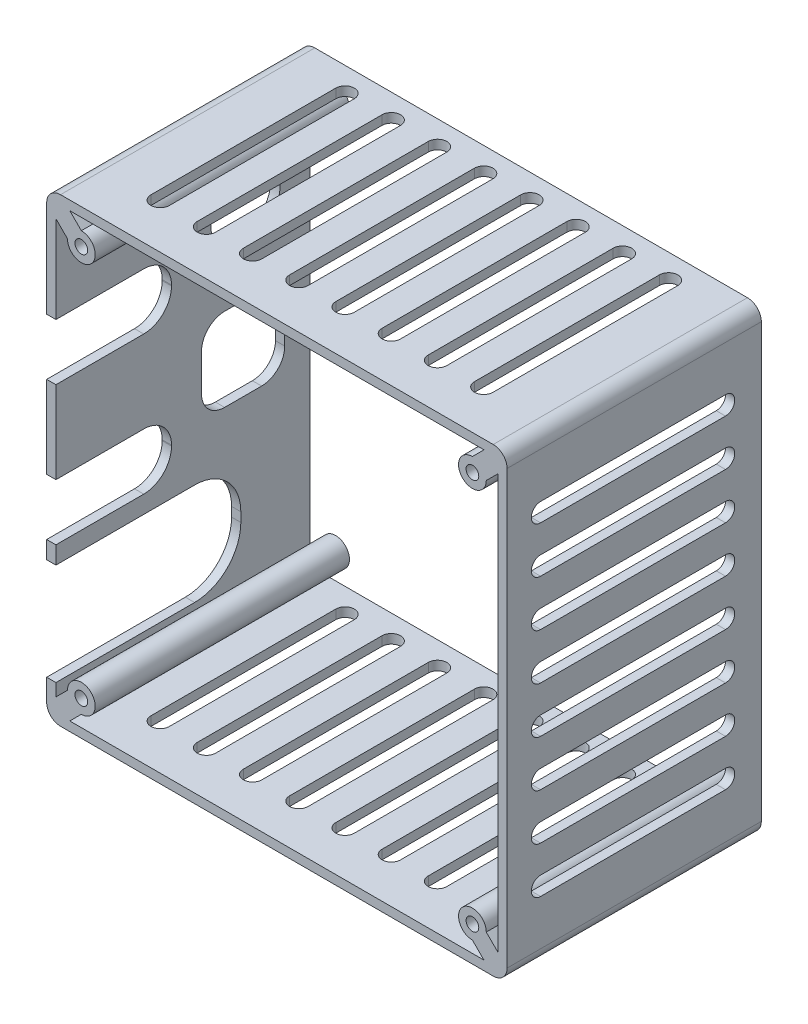
from build123d import *

# Parameters (mm, degrees)
BOSS_EXTRUDE1_DEPTH      = 3
BOSS_EXTRUDE1_DEPTH_BACK = 1.5
SKETCH1_W                = 99.6
SKETCH1_H                = 99.6
SKETCH1_R                = 7.5
SKETCH2_W                = 99.6
SKETCH2_H                = 99.6
SKETCH2_W_2              = 95.6
SKETCH2_H_2              = 95.6
BOSS_EXTRUDE2_DEPTH      = 55
FILLET1_R                = 3
SKETCH5_R                = 3
BOSS_EXTRUDE4_DEPTH      = 55
SKETCH6_R                = 1.375
CUT_EXTRUDE2_DEPTH       = 10
CUT_EXTRUDE4_START       = -99.6
CUT_EXTRUDE4_DEPTH       = 99.6
SKETCH8_W                = 25
SKETCH8_H                = 12.2
CUT_EXTRUDE5_DEPTH       = 10
CUT_EXTRUDE13_DEPTH      = 4.5
SKETCH20_7_W             = 13.718214861
SKETCH20_7_H             = 12
CUT_EXTRUDE16_DEPTH      = 4.5
CUT_EXTRUDE17_DEPTH      = 10
SKETCH26_R               = 2
CUT_EXTRUDE21_DEPTH      = 4.5
SKETCH29_R               = 2
BOSS_EXTRUDE9_DEPTH      = 4.5
SKETCH30_R               = 2
CUT_EXTRUDE23_DEPTH      = 4.5
CRVPATTERN2_START        = -1.5
CRVPATTERN2_OUTLINE_R    = 2
CRVPATTERN2_DEPTH        = 4.5
SKETCH32_R               = 2
CUT_EXTRUDE24_DEPTH      = 4.5
CRVPATTERN3_START        = -1.5
CRVPATTERN3_OUTLINE_R    = 2
CRVPATTERN3_DEPTH        = 4.5
SKETCH36_R               = 2
CUT_EXTRUDE25_DEPTH      = 4.5
CRVPATTERN4_START        = -1.5
CRVPATTERN4_OUTLINE_R    = 2
CRVPATTERN4_DEPTH        = 4.5
SKETCH37_W               = 26.02554601
SKETCH37_H               = 3
SKETCH37_W_2             = 26.013358107
BOSS_EXTRUDE11_DEPTH     = 4.5
FILLET2_R                = 30
SKETCH38_R               = 2.5
SKETCH38_R_2             = 1.5
BOSS_EXTRUDE12_DEPTH     = 7
CUT_EXTRUDE27_DEPTH      = 2
CUT_EXTRUDE28_START      = 7
SKETCH40_R               = 1.375
CUT_EXTRUDE28_DEPTH      = 7
CUT_EXTRUDE31_DEPTH      = 7
CUT_EXTRUDE33_DEPTH      = 7
BOSS_EXTRUDE13_DEPTH     = 55
SKETCH45_W               = 40
SKETCH45_H               = 22
CUT_EXTRUDE34_DEPTH      = 2
SKETCH46_R               = 7.5
CUT_EXTRUDE35_DEPTH      = 10
FILLET3_R                = 6
FILLET4_R                = 10


# Read off the part's stored shape, not the designer's step: CrvPattern2, CrvPattern3, CrvPattern4
with BuildPart() as part:
    # Sketch1 → Boss-Extrude1 (new, two sides: drawn at the far end of the back side and taken through both)
    with BuildSketch(Plane.XY.offset(-BOSS_EXTRUDE1_DEPTH_BACK)):
        with Locations((-24.95, -0.2)):
            Rectangle(SKETCH1_W, SKETCH1_H)
        with Locations((-21.854673791, 0)):
            Circle(SKETCH1_R, mode=Mode.SUBTRACT)
    extrude(amount=BOSS_EXTRUDE1_DEPTH + BOSS_EXTRUDE1_DEPTH_BACK)

    # Sketch2 → Boss-Extrude2 (add)
    with BuildSketch(Plane.XY.offset(3)):
        with Locations((-24.95, -0.2)):
            Rectangle(SKETCH2_W, SKETCH2_H)
        with Locations((-24.95, -0.2)):
            Rectangle(SKETCH2_W_2, SKETCH2_H_2, mode=Mode.SUBTRACT)
    extrude(amount=BOSS_EXTRUDE2_DEPTH)

    # Fillet1
    fillet1_edges = [part.edges().sort_by_distance(p)[0] for p in [
        (-72.75, -48, 30.5),
        (22.85, -48, 30.5),
        (22.85, 47.6, 30.5),
        (-72.75, 47.6, 30.5),
        (-74.75, 49.6, 28.25),
        (24.85, 49.6, 28.25),
        (24.85, -50, 28.25),
        (-74.75, -50, 28.25),
    ]]
    fillet(fillet1_edges, radius=FILLET1_R)

    # Sketch5 → Boss-Extrude4 (add)
    with BuildSketch(Plane.XY.offset(3)):
        with Locations((17.35, 42.1)):
            Circle(SKETCH5_R)
        with Locations((17.35, -42.5)):
            Circle(SKETCH5_R)
        with Locations((-67.25, 42.1)):
            Circle(SKETCH5_R)
        with Locations((-67.25, -42.5)):
            Circle(SKETCH5_R)
    extrude(amount=BOSS_EXTRUDE4_DEPTH)

    # Sketch6 → Cut-Extrude2 (cut)
    with BuildSketch(Plane.XY.offset(58)):
        with Locations((17.35, 42.1)):
            Circle(SKETCH6_R)
        with Locations((17.35, -42.5)):
            Circle(SKETCH6_R)
        with Locations((-67.25, -42.5)):
            Circle(SKETCH6_R)
        with Locations((-67.25, 42.1)):
            Circle(SKETCH6_R)
    extrude(amount=-CUT_EXTRUDE2_DEPTH, mode=Mode.SUBTRACT)

    # Sketch7 → Cut-Extrude4 (cut)
    with BuildSketch(Plane.XZ.offset(50).offset(CUT_EXTRUDE4_START)):
        with BuildLine():
            Line((12.05, 8.25), (12.05, 48.25))
            ThreePointArc((12.05, 48.25), (10.05, 50.25), (8.05, 48.25))
            Line((8.05, 48.25), (8.05, 8.25))
            ThreePointArc((8.05, 8.25), (10.05, 6.25), (12.05, 8.25))
        make_face()
        with BuildLine():
            Line((-1.95, 8.25), (-1.95, 48.25))
            ThreePointArc((-1.95, 48.25), (0.05, 50.25), (2.05, 48.25))
            Line((2.05, 48.25), (2.05, 8.25))
            ThreePointArc((2.05, 8.25), (0.05, 6.25), (-1.95, 8.25))
        make_face()
        with BuildLine():
            Line((-11.95, 8.25), (-11.95, 48.25))
            ThreePointArc((-11.95, 48.25), (-9.95, 50.25), (-7.95, 48.25))
            Line((-7.95, 48.25), (-7.95, 8.25))
            ThreePointArc((-7.95, 8.25), (-9.95, 6.25), (-11.95, 8.25))
        make_face()
        with BuildLine():
            Line((-21.95, 8.25), (-21.95, 48.25))
            ThreePointArc((-21.95, 48.25), (-19.95, 50.25), (-17.95, 48.25))
            Line((-17.95, 48.25), (-17.95, 8.25))
            ThreePointArc((-17.95, 8.25), (-19.95, 6.25), (-21.95, 8.25))
        make_face()
        with BuildLine():
            Line((-31.95, 8.25), (-31.95, 48.25))
            ThreePointArc((-31.95, 48.25), (-29.95, 50.25), (-27.95, 48.25))
            Line((-27.95, 48.25), (-27.95, 8.25))
            ThreePointArc((-27.95, 8.25), (-29.95, 6.25), (-31.95, 8.25))
        make_face()
        with BuildLine():
            Line((-41.95, 8.25), (-41.95, 48.25))
            ThreePointArc((-41.95, 48.25), (-39.95, 50.25), (-37.95, 48.25))
            Line((-37.95, 48.25), (-37.95, 8.25))
            ThreePointArc((-37.95, 8.25), (-39.95, 6.25), (-41.95, 8.25))
        make_face()
        with BuildLine():
            Line((-51.95, 8.25), (-51.95, 48.25))
            ThreePointArc((-51.95, 48.25), (-49.95, 50.25), (-47.95, 48.25))
            Line((-47.95, 48.25), (-47.95, 8.25))
            ThreePointArc((-47.95, 8.25), (-49.95, 6.25), (-51.95, 8.25))
        make_face()
        with BuildLine():
            Line((-61.95, 8.25), (-61.95, 48.25))
            ThreePointArc((-61.95, 48.25), (-59.95, 50.25), (-57.95, 48.25))
            Line((-57.95, 48.25), (-57.95, 8.25))
            ThreePointArc((-57.95, 8.25), (-59.95, 6.25), (-61.95, 8.25))
        make_face()
    cut_extrude4 = extrude(amount=CUT_EXTRUDE4_DEPTH, mode=Mode.SUBTRACT)

    # Mirror1: Cut-Extrude4 across plane
    add(cut_extrude4.mirror(Plane.ZX), mode=Mode.SUBTRACT)

    # Sketch8 → Cut-Extrude5 (cut)
    with BuildSketch(Plane.ZY.offset(74.75)):
        with Locations((45.5, -10.4)):
            Rectangle(SKETCH8_W, SKETCH8_H)
        with Locations((45.5, 19.6)):
            Rectangle(SKETCH8_W, SKETCH8_H)
    extrude(amount=-CUT_EXTRUDE5_DEPTH, mode=Mode.SUBTRACT)

    # Sketch20 → Cut-Extrude13 (cut)
    with BuildSketch(Plane(origin=(0, 0, -1.5), x_dir=(-1, 0, 0), z_dir=(0, 0, -1))):
        with BuildLine():
            ThreePointArc((24.75, -47), (71.75, 0), (24.75, 47))
            Line((24.75, 47), (24.75, 35))
            ThreePointArc((24.75, 35), (59.75, 0), (24.75, -35))
            Line((24.75, -35), (24.75, -47))
        make_face()
    extrude(amount=-CUT_EXTRUDE13_DEPTH, mode=Mode.SUBTRACT)

    # Sketch20<7> → Cut-Extrude16 (cut)
    with BuildSketch(Plane(origin=(0, 0, -1.5), x_dir=(-1, 0, 0), z_dir=(0, 0, -1))):
        with Locations((17.89089257, 41)):
            Rectangle(SKETCH20_7_W, SKETCH20_7_H)
        with Locations((17.89089257, -41)):
            Rectangle(SKETCH20_7_W, SKETCH20_7_H)
    extrude(amount=-CUT_EXTRUDE16_DEPTH, mode=Mode.SUBTRACT)

    # Sketch21 → Cut-Extrude17 (cut)
    with BuildSketch(Plane.ZY.offset(74.75)):
        with BuildLine():
            Line((13.5, -9), (21.5, -9))
            ThreePointArc((21.5, -9), (25.035533906, -7.535533906), (26.5, -4))
            Line((26.5, -4), (26.5, 4))
            ThreePointArc((26.5, 4), (25.035533906, 7.535533906), (21.5, 9))
            Line((21.5, 9), (13.5, 9))
            ThreePointArc((13.5, 9), (9.964466094, 7.535533906), (8.5, 4))
            Line((8.5, 4), (8.5, -4))
            ThreePointArc((8.5, -4), (9.964466094, -7.535533906), (13.5, -9))
        make_face()
    extrude(amount=-CUT_EXTRUDE17_DEPTH, mode=Mode.SUBTRACT)

    # Sketch26 → Cut-Extrude21 (cut)
    with BuildSketch(Plane(origin=(0, 0, -1.5), x_dir=(-1, 0, 0), z_dir=(0, 0, -1))):
        with Locations((-19.85, -45)):
            Circle(SKETCH26_R)
        with Locations((-19.85, -40)):
            Circle(SKETCH26_R)
        with Locations((-19.85, -35)):
            Circle(SKETCH26_R)
        with Locations((-19.85, -30)):
            Circle(SKETCH26_R)
        with Locations((-19.85, -25)):
            Circle(SKETCH26_R)
        with Locations((-19.85, -20)):
            Circle(SKETCH26_R)
        with Locations((-19.85, -15)):
            Circle(SKETCH26_R)
        with Locations((-19.85, -10)):
            Circle(SKETCH26_R)
        with Locations((-19.85, -5)):
            Circle(SKETCH26_R)
        with Locations((-19.85, 0)):
            Circle(SKETCH26_R)
        with Locations((-19.85, 5)):
            Circle(SKETCH26_R)
        with Locations((-19.85, 10)):
            Circle(SKETCH26_R)
        with Locations((-19.85, 15)):
            Circle(SKETCH26_R)
        with Locations((-19.85, 20)):
            Circle(SKETCH26_R)
        with Locations((-19.85, 25)):
            Circle(SKETCH26_R)
        with Locations((-19.85, 30)):
            Circle(SKETCH26_R)
        with Locations((-19.85, 35)):
            Circle(SKETCH26_R)
        with Locations((-19.85, 40)):
            Circle(SKETCH26_R)
        with Locations((-19.85, 45)):
            Circle(SKETCH26_R)
        with Locations((-14.85, -45)):
            Circle(SKETCH26_R)
        with Locations((-9.85, -45)):
            Circle(SKETCH26_R)
        with Locations((-4.85, -45)):
            Circle(SKETCH26_R)
        with Locations((0.15, -45)):
            Circle(SKETCH26_R)
        with Locations((5.15, -45)):
            Circle(SKETCH26_R)
        with Locations((-14.85, -40)):
            Circle(SKETCH26_R)
        with Locations((-9.85, -40)):
            Circle(SKETCH26_R)
        with Locations((-4.85, -40)):
            Circle(SKETCH26_R)
        with Locations((0.15, -40)):
            Circle(SKETCH26_R)
        with Locations((5.15, -40)):
            Circle(SKETCH26_R)
        with Locations((-14.85, -35)):
            Circle(SKETCH26_R)
        with Locations((-9.85, -35)):
            Circle(SKETCH26_R)
        with Locations((-4.85, -35)):
            Circle(SKETCH26_R)
        with Locations((0.15, -35)):
            Circle(SKETCH26_R)
        with Locations((5.15, -35)):
            Circle(SKETCH26_R)
        with Locations((-14.85, -30)):
            Circle(SKETCH26_R)
        with Locations((-9.85, -30)):
            Circle(SKETCH26_R)
        with Locations((-4.85, -30)):
            Circle(SKETCH26_R)
        with Locations((0.15, -30)):
            Circle(SKETCH26_R)
        with Locations((5.15, -30)):
            Circle(SKETCH26_R)
        with Locations((-14.85, -25)):
            Circle(SKETCH26_R)
        with Locations((-9.85, -25)):
            Circle(SKETCH26_R)
        with Locations((-4.85, -25)):
            Circle(SKETCH26_R)
        with Locations((0.15, -25)):
            Circle(SKETCH26_R)
        with Locations((5.15, -25)):
            Circle(SKETCH26_R)
        with Locations((-14.85, -20)):
            Circle(SKETCH26_R)
        with Locations((-9.85, -20)):
            Circle(SKETCH26_R)
        with Locations((-4.85, -20)):
            Circle(SKETCH26_R)
        with Locations((0.15, -20)):
            Circle(SKETCH26_R)
        with Locations((5.15, -20)):
            Circle(SKETCH26_R)
        with Locations((-14.85, -15)):
            Circle(SKETCH26_R)
        with Locations((-9.85, -15)):
            Circle(SKETCH26_R)
        with Locations((-4.85, -15)):
            Circle(SKETCH26_R)
        with Locations((0.15, -15)):
            Circle(SKETCH26_R)
        with Locations((5.15, -15)):
            Circle(SKETCH26_R)
        with Locations((-14.85, -10)):
            Circle(SKETCH26_R)
        with Locations((-9.85, -10)):
            Circle(SKETCH26_R)
        with Locations((-14.85, 0)):
            Circle(SKETCH26_R)
        with Locations((-9.85, 0)):
            Circle(SKETCH26_R)
        with Locations((-14.85, 10)):
            Circle(SKETCH26_R)
        with Locations((-9.85, 10)):
            Circle(SKETCH26_R)
        with Locations((-14.85, 15)):
            Circle(SKETCH26_R)
        with Locations((-9.85, 15)):
            Circle(SKETCH26_R)
        with Locations((-4.85, 15)):
            Circle(SKETCH26_R)
        with Locations((0.15, 15)):
            Circle(SKETCH26_R)
        with Locations((5.15, 15)):
            Circle(SKETCH26_R)
        with Locations((-14.85, 20)):
            Circle(SKETCH26_R)
        with Locations((-9.85, 20)):
            Circle(SKETCH26_R)
        with Locations((-4.85, 20)):
            Circle(SKETCH26_R)
        with Locations((0.15, 20)):
            Circle(SKETCH26_R)
        with Locations((5.15, 20)):
            Circle(SKETCH26_R)
        with Locations((-14.85, 25)):
            Circle(SKETCH26_R)
        with Locations((-9.85, 25)):
            Circle(SKETCH26_R)
        with Locations((-4.85, 25)):
            Circle(SKETCH26_R)
        with Locations((0.15, 25)):
            Circle(SKETCH26_R)
        with Locations((5.15, 25)):
            Circle(SKETCH26_R)
        with Locations((-14.85, 30)):
            Circle(SKETCH26_R)
        with Locations((-9.85, 30)):
            Circle(SKETCH26_R)
        with Locations((-4.85, 30)):
            Circle(SKETCH26_R)
        with Locations((0.15, 30)):
            Circle(SKETCH26_R)
        with Locations((5.15, 30)):
            Circle(SKETCH26_R)
        with Locations((-14.85, 35)):
            Circle(SKETCH26_R)
        with Locations((-9.85, 35)):
            Circle(SKETCH26_R)
        with Locations((-4.85, 35)):
            Circle(SKETCH26_R)
        with Locations((0.15, 35)):
            Circle(SKETCH26_R)
        with Locations((5.15, 35)):
            Circle(SKETCH26_R)
        with Locations((-14.85, 40)):
            Circle(SKETCH26_R)
        with Locations((-9.85, 40)):
            Circle(SKETCH26_R)
        with Locations((-4.85, 40)):
            Circle(SKETCH26_R)
        with Locations((0.15, 40)):
            Circle(SKETCH26_R)
        with Locations((5.15, 40)):
            Circle(SKETCH26_R)
        with Locations((-14.85, 45)):
            Circle(SKETCH26_R)
        with Locations((-9.85, 45)):
            Circle(SKETCH26_R)
        with Locations((-4.85, 45)):
            Circle(SKETCH26_R)
        with Locations((0.15, 45)):
            Circle(SKETCH26_R)
        with Locations((5.15, 45)):
            Circle(SKETCH26_R)
        with Locations((10.15, -30)):
            Circle(SKETCH26_R)
        with Locations((10.15, -25)):
            Circle(SKETCH26_R)
        with Locations((10.15, -20)):
            Circle(SKETCH26_R)
        with Locations((10.15, -15)):
            Circle(SKETCH26_R)
        with Locations((10.15, 15)):
            Circle(SKETCH26_R)
        with Locations((10.15, 20)):
            Circle(SKETCH26_R)
        with Locations((10.15, 25)):
            Circle(SKETCH26_R)
        with Locations((10.15, 30)):
            Circle(SKETCH26_R)
    extrude(amount=-CUT_EXTRUDE21_DEPTH, mode=Mode.SUBTRACT)

    # Sketch29 → Boss-Extrude9 (add)
    with BuildSketch(Plane(origin=(0, 0, -1.5), x_dir=(-1, 0, 0), z_dir=(0, 0, -1))):
        with Locations((-19.85, 40)):
            Circle(SKETCH29_R)
        with Locations((-19.85, 45)):
            Circle(SKETCH29_R)
        with Locations((-14.85, 45)):
            Circle(SKETCH29_R)
        with Locations((-14.85, 40)):
            Circle(SKETCH29_R)
        with Locations((-19.85, -40)):
            Circle(SKETCH29_R)
        with Locations((-19.85, -45)):
            Circle(SKETCH29_R)
        with Locations((-14.85, -45)):
            Circle(SKETCH29_R)
        with Locations((-14.85, -40)):
            Circle(SKETCH29_R)
    extrude(amount=-BOSS_EXTRUDE9_DEPTH)

    # Sketch30 → Cut-Extrude23 (cut)
    with BuildSketch(Plane(origin=(0, 0, -1.5), x_dir=(-1, 0, 0), z_dir=(0, 0, -1))):
        with Locations((14.95, 20)):
            Circle(SKETCH30_R)
    extrude(amount=-CUT_EXTRUDE23_DEPTH, mode=Mode.SUBTRACT)

    # CrvPattern2 outline → CrvPattern2 (cut)
    with BuildSketch(Plane.XY.offset(CRVPATTERN2_START)):
        with Locations((-20.098772525, 19.996958712)):
            Circle(CRVPATTERN2_OUTLINE_R)
        with Locations((-25.178610025, 19.249160844)):
            Circle(CRVPATTERN2_OUTLINE_R)
        with Locations((-29.900648507, 17.232653159)):
            Circle(CRVPATTERN2_OUTLINE_R)
        with Locations((-33.953658998, 14.080343429)):
            Circle(CRVPATTERN2_OUTLINE_R)
        with Locations((-34.197040973, -13.830510009)):
            Circle(CRVPATTERN2_OUTLINE_R)
        with Locations((-30.199618752, -17.05301932)):
            Circle(CRVPATTERN2_OUTLINE_R)
        with Locations((-25.513463448, -19.151566231)):
            Circle(CRVPATTERN2_OUTLINE_R)
        with Locations((-20.447438978, -19.987835773)):
            Circle(CRVPATTERN2_OUTLINE_R)
        with Locations((-15.298790205, -20)):
            Circle(CRVPATTERN2_OUTLINE_R)
    extrude(amount=CRVPATTERN2_DEPTH, mode=Mode.SUBTRACT)

    # Sketch32 → Cut-Extrude24 (cut)
    with BuildSketch(Plane(origin=(0, 0, -1.5), x_dir=(-1, 0, 0), z_dir=(0, 0, -1))):
        with Locations((14.95, 15)):
            Circle(SKETCH32_R)
    extrude(amount=-CUT_EXTRUDE24_DEPTH, mode=Mode.SUBTRACT)

    # CrvPattern3 outline → CrvPattern3 (cut)
    with BuildSketch(Plane.XY.offset(CRVPATTERN3_START)):
        with Locations((-20.542711439, 14.979038974)):
            Circle(CRVPATTERN3_OUTLINE_R)
        with Locations((-25.944978829, 13.660974976)):
            Circle(CRVPATTERN3_OUTLINE_R)
        with Locations((-30.495869297, 10.465481024)):
            Circle(CRVPATTERN3_OUTLINE_R)
        with Locations((-31.033926769, -9.882964974)):
            Circle(CRVPATTERN3_OUTLINE_R)
        with Locations((-26.658269364, -13.3144964)):
            Circle(CRVPATTERN3_OUTLINE_R)
        with Locations((-21.333207406, -14.916214477)):
            Circle(CRVPATTERN3_OUTLINE_R)
        with Locations((-15.743080891, -15)):
            Circle(CRVPATTERN3_OUTLINE_R)
    extrude(amount=CRVPATTERN3_DEPTH, mode=Mode.SUBTRACT)

    # Sketch36 → Cut-Extrude25 (cut)
    with BuildSketch(Plane(origin=(0, 0, -1.5), x_dir=(-1, 0, 0), z_dir=(0, 0, -1))):
        with Locations((14.95, 25)):
            Circle(SKETCH36_R)
    extrude(amount=-CUT_EXTRUDE25_DEPTH, mode=Mode.SUBTRACT)

    # CrvPattern4 outline → CrvPattern4 (cut)
    with BuildSketch(Plane.XY.offset(CRVPATTERN4_START)):
        with Locations((-20.416968875, 24.991101467)):
            Circle(CRVPATTERN4_OUTLINE_R)
        with Locations((-15.61704802, -25)):
            Circle(CRVPATTERN4_OUTLINE_R)
        with Locations((-21.083462946, -24.964412202)):
            Circle(CRVPATTERN4_OUTLINE_R)
        with Locations((-26.467563085, -24.080580271)):
            Circle(CRVPATTERN4_OUTLINE_R)
        with Locations((-42.536029609, -10.285759799)):
            Circle(CRVPATTERN4_OUTLINE_R)
        with Locations((-39.76193826, -14.98406911)):
            Circle(CRVPATTERN4_OUTLINE_R)
        with Locations((-36.034648091, -18.968664596)):
            Circle(CRVPATTERN4_OUTLINE_R)
        with Locations((-31.531695558, -22.049753962)):
            Circle(CRVPATTERN4_OUTLINE_R)
        with Locations((-44.224787982, -5.097524227)):
            Circle(CRVPATTERN4_OUTLINE_R)
        with Locations((-44.747775268, 0.333514117)):
            Circle(CRVPATTERN4_OUTLINE_R)
        with Locations((-44.080080793, 5.74866668)):
            Circle(CRVPATTERN4_OUTLINE_R)
        with Locations((-42.253507854, 10.890001574)):
            Circle(CRVPATTERN4_OUTLINE_R)
        with Locations((-35.522791356, 19.396367001)):
            Circle(CRVPATTERN4_OUTLINE_R)
        with Locations((-39.355058875, 15.512629258)):
            Circle(CRVPATTERN4_OUTLINE_R)
        with Locations((-30.939241982, 22.356226512)):
            Circle(CRVPATTERN4_OUTLINE_R)
        with Locations((-25.822732126, 24.251225217)):
            Circle(CRVPATTERN4_OUTLINE_R)
    extrude(amount=CRVPATTERN4_DEPTH, mode=Mode.SUBTRACT)

    # Sketch37 → Boss-Extrude11 (add)
    with BuildSketch(Plane(origin=(0, 0, -1.5), x_dir=(-1, 0, 0), z_dir=(0, 0, -1))):
        with Locations((24.044558144, -46.86)):
            Rectangle(SKETCH37_W, SKETCH37_H)
        with Locations((24.038464193, 46.863305133)):
            Rectangle(SKETCH37_W_2, SKETCH37_H)
    extrude(amount=-BOSS_EXTRUDE11_DEPTH)

    # Fillet2
    fillet2_edges = [part.edges().sort_by_distance(p)[0] for p in [
        (-37.057331149, -45.36, 0.75),
        (-37.045143246, 45.363305133, 0.75),
    ]]
    fillet(fillet2_edges, radius=FILLET2_R)

    # Sketch38 → Boss-Extrude12 (add)
    # profile 1 of 4: a face of its own
    with BuildSketch(Plane.XY.offset(3)):
        with Locations((-36.604673791, -5)):
            Circle(SKETCH38_R)
        with Locations((-36.604673791, -5)):
            Circle(SKETCH38_R_2, mode=Mode.SUBTRACT)
    # profile 2 of 4: a face of its own
    with BuildSketch(Plane.XY.offset(3)):
        with Locations((-36.604673791, 5)):
            Circle(SKETCH38_R)
        with Locations((-36.604673791, 5)):
            Circle(SKETCH38_R_2, mode=Mode.SUBTRACT)
    # profile 3 of 4: a face of its own
    with BuildSketch(Plane.XY.offset(3)):
        with Locations((13.395326209, 5)):
            Circle(SKETCH38_R)
        with Locations((13.395326209, 5)):
            Circle(SKETCH38_R_2, mode=Mode.SUBTRACT)
    # profile 4 of 4: a face of its own
    with BuildSketch(Plane.XY.offset(3)):
        with Locations((13.395326209, -5)):
            Circle(SKETCH38_R)
        with Locations((13.395326209, -5)):
            Circle(SKETCH38_R_2, mode=Mode.SUBTRACT)
    extrude(amount=BOSS_EXTRUDE12_DEPTH)

    # Sketch39 → Cut-Extrude27 (cut)
    with BuildSketch(Plane(origin=(24.85, 0, 0), x_dir=(0, 0, -1), z_dir=(1, 0, 0))):
        with BuildLine():
            Line((-10.75, 36.8), (-50.75, 36.8))
            ThreePointArc((-50.75, 36.8), (-52.75, 34.8), (-50.75, 32.8))
            Line((-50.75, 32.8), (-10.75, 32.8))
            ThreePointArc((-10.75, 32.8), (-8.75, 34.8), (-10.75, 36.8))
        make_face()
        with BuildLine():
            Line((-50.75, 22.8), (-10.75, 22.8))
            ThreePointArc((-10.75, 22.8), (-8.75, 24.8), (-10.75, 26.8))
            Line((-10.75, 26.8), (-50.75, 26.8))
            ThreePointArc((-50.75, 26.8), (-52.75, 24.8), (-50.75, 22.8))
        make_face()
        with BuildLine():
            Line((-50.75, 12.8), (-10.75, 12.8))
            ThreePointArc((-10.75, 12.8), (-8.75, 14.8), (-10.75, 16.8))
            Line((-10.75, 16.8), (-50.75, 16.8))
            ThreePointArc((-50.75, 16.8), (-52.75, 14.8), (-50.75, 12.8))
        make_face()
        with BuildLine():
            Line((-50.75, 2.8), (-10.75, 2.8))
            ThreePointArc((-10.75, 2.8), (-8.75, 4.8), (-10.75, 6.8))
            Line((-10.75, 6.8), (-50.75, 6.8))
            ThreePointArc((-50.75, 6.8), (-52.75, 4.8), (-50.75, 2.8))
        make_face()
        with BuildLine():
            Line((-50.75, -7.2), (-10.75, -7.2))
            ThreePointArc((-10.75, -7.2), (-8.75, -5.2), (-10.75, -3.2))
            Line((-10.75, -3.2), (-50.75, -3.2))
            ThreePointArc((-50.75, -3.2), (-52.75, -5.2), (-50.75, -7.2))
        make_face()
        with BuildLine():
            Line((-50.75, -17.2), (-10.75, -17.2))
            ThreePointArc((-10.75, -17.2), (-8.75, -15.2), (-10.75, -13.2))
            Line((-10.75, -13.2), (-50.75, -13.2))
            ThreePointArc((-50.75, -13.2), (-52.75, -15.2), (-50.75, -17.2))
        make_face()
        with BuildLine():
            Line((-50.75, -27.2), (-10.75, -27.2))
            ThreePointArc((-10.75, -27.2), (-8.75, -25.2), (-10.75, -23.2))
            Line((-10.75, -23.2), (-50.75, -23.2))
            ThreePointArc((-50.75, -23.2), (-52.75, -25.2), (-50.75, -27.2))
        make_face()
        with BuildLine():
            Line((-50.75, -37.2), (-10.75, -37.2))
            ThreePointArc((-10.75, -37.2), (-8.75, -35.2), (-10.75, -33.2))
            Line((-10.75, -33.2), (-50.75, -33.2))
            ThreePointArc((-50.75, -33.2), (-52.75, -35.2), (-50.75, -37.2))
        make_face()
    extrude(amount=-CUT_EXTRUDE27_DEPTH, mode=Mode.SUBTRACT)

    # Sketch40 → Cut-Extrude28 (cut)
    with BuildSketch(Plane.XY.offset(3).offset(CUT_EXTRUDE28_START)):
        with Locations((17.35, 42.1)):
            Circle(SKETCH40_R)
        with Locations((-67.25, 42.1)):
            Circle(SKETCH40_R)
        with Locations((-67.25, -42.5)):
            Circle(SKETCH40_R)
        with Locations((17.35, -42.5)):
            Circle(SKETCH40_R)
    extrude(amount=-CUT_EXTRUDE28_DEPTH, mode=Mode.SUBTRACT)

    # Sketch41 → Cut-Extrude31 (cut)
    with BuildSketch(Plane.XY.offset(3)):
        Polygon((40.574325003, 47.635477722), (37.561143253, -67.654972022), (-85.296066717, -64.444028673), (-81.952431515, 63.490240903), (40.574325003, 60.287934143), align=None)
    extrude(amount=-CUT_EXTRUDE31_DEPTH, mode=Mode.SUBTRACT)


with BuildPart() as cut_extrude31_piece_1:
    # of the separate pieces the step leaves, piece 1, a body of its own (cut_extrude31_pieces)
    add(part.part.solids().sort_by_distance((22.85, -45, 3))[0])



with BuildPart() as cut_extrude31_piece_2:
    # of the separate pieces the step leaves, piece 2, a body of its own (cut_extrude31_pieces)
    add(part.part.solids().sort_by_distance((20.35, 42.1, 3))[0])


with BuildPart() as cut_extrude31_piece_3:
    # of the separate pieces the step leaves, piece 3, a body of its own (cut_extrude31_pieces)
    add(part.part.solids().sort_by_distance((20.35, -42.5, 3))[0])


with BuildPart() as cut_extrude31_piece_4:
    # of the separate pieces the step leaves, piece 4, a body of its own (cut_extrude31_pieces)
    add(part.part.solids().sort_by_distance((-64.25, 42.1, 3))[0])


with BuildPart() as cut_extrude31_piece_5:
    # of the separate pieces the step leaves, piece 5, a body of its own (cut_extrude31_pieces)
    add(part.part.solids().sort_by_distance((-64.25, -42.5, 3))[0])


with BuildPart() as cut_extrude31_piece_6:
    # of the separate pieces the step leaves, piece 6, a body of its own (cut_extrude31_pieces)
    add(part.part.solids().sort_by_distance((15.895326209, -5, 3))[0])


with BuildPart() as cut_extrude31_piece_7:
    # of the separate pieces the step leaves, piece 7, a body of its own (cut_extrude31_pieces)
    add(part.part.solids().sort_by_distance((15.895326209, 5, 3))[0])


with BuildPart() as cut_extrude31_piece_8:
    # of the separate pieces the step leaves, piece 8, a body of its own (cut_extrude31_pieces)
    add(part.part.solids().sort_by_distance((-34.104673791, -5, 3))[0])


with BuildPart() as cut_extrude31_piece_9:
    # of the separate pieces the step leaves, piece 9, a body of its own (cut_extrude31_pieces)
    add(part.part.solids().sort_by_distance((-34.104673791, 5, 3))[0])


with BuildPart() as cut_extrude33_tool:
    # Sketch42 → Cut-Extrude33 (new body)
    with BuildSketch(Plane.XY.offset(10)):
        Polygon((17.605940303, 12.098788171), (17.605940303, -17.565875069), (-47.201651415, -12.88486728), (-48.391343705, 14.688852341), align=None)
    extrude(amount=-CUT_EXTRUDE33_DEPTH)


with BuildPart() as cut_extrude31_piece_6_1:
    add(cut_extrude31_piece_6.part)

    # Cut-Extrude33: cut by cut_extrude33_tool
    add(cut_extrude33_tool.part, mode=Mode.SUBTRACT)


with BuildPart() as cut_extrude31_piece_7_1:
    add(cut_extrude31_piece_7.part)

    # Cut-Extrude33: cut by cut_extrude33_tool
    add(cut_extrude33_tool.part, mode=Mode.SUBTRACT)


with BuildPart() as cut_extrude31_piece_8_1:
    add(cut_extrude31_piece_8.part)

    # Cut-Extrude33: cut by cut_extrude33_tool
    add(cut_extrude33_tool.part, mode=Mode.SUBTRACT)


with BuildPart() as cut_extrude31_piece_9_1:
    add(cut_extrude31_piece_9.part)

    # Cut-Extrude33: cut by cut_extrude33_tool
    add(cut_extrude33_tool.part, mode=Mode.SUBTRACT)


with BuildPart() as cut_extrude31_piece_1_1:
    add(cut_extrude31_piece_1.part)

    add(cut_extrude31_piece_2.part)  # Boss-Extrude13 merges Cut-Extrude31 piece 2

    add(cut_extrude31_piece_3.part)  # Boss-Extrude13 merges Cut-Extrude31 piece 3

    add(cut_extrude31_piece_4.part)  # Boss-Extrude13 merges Cut-Extrude31 piece 4

    add(cut_extrude31_piece_5.part)  # Boss-Extrude13 merges Cut-Extrude31 piece 5
    # Sketch43 → Boss-Extrude13 (add)
    with BuildSketch(Plane.XY.offset(58)):
        with BuildLine():
            Line((19.85, -48), (17.35, -45.5))
            ThreePointArc((17.35, -45.5), (19.471320344, -44.621320344), (20.35, -42.5))
            Line((20.35, -42.5), (22.85, -45))
            ThreePointArc((22.85, -45), (21.971320344, -47.121320344), (19.85, -48))
        make_face()
        with BuildLine():
            Line((-69.75, -48), (-67.25, -45.5))
            ThreePointArc((-67.25, -45.5), (-69.371320344, -44.621320344), (-70.25, -42.5))
            Line((-70.25, -42.5), (-72.75, -45))
            ThreePointArc((-72.75, -45), (-71.871320344, -47.121320344), (-69.75, -48))
        make_face()
        with BuildLine():
            Line((17.35, 45.1), (19.85, 47.6))
            ThreePointArc((19.85, 47.6), (21.971320344, 46.721320344), (22.85, 44.6))
            Line((22.85, 44.6), (20.35, 42.1))
            ThreePointArc((20.35, 42.1), (19.471320344, 44.221320344), (17.35, 45.1))
        make_face()
        with BuildLine():
            Line((-72.75, 44.6), (-70.25, 42.1))
            ThreePointArc((-70.25, 42.1), (-69.371320344, 44.221320344), (-67.25, 45.1))
            Line((-67.25, 45.1), (-69.75, 47.6))
            ThreePointArc((-69.75, 47.6), (-71.871320344, 46.721320344), (-72.75, 44.6))
        make_face()
    extrude(amount=-BOSS_EXTRUDE13_DEPTH)

    # Sketch45 → Cut-Extrude34 (cut)
    with BuildSketch(Plane.ZY.offset(74.75)):
        with Locations((38, -31.302606258)):
            Rectangle(SKETCH45_W, SKETCH45_H)
    extrude(amount=-CUT_EXTRUDE34_DEPTH, mode=Mode.SUBTRACT)

    # Sketch46 → Cut-Extrude35 (cut)
    with BuildSketch(Plane.ZY.offset(74.75)):
        with Locations(Location((17, 26.6, 0), (0, 0, 270))):
            Circle(SKETCH46_R)
    extrude(amount=-CUT_EXTRUDE35_DEPTH, mode=Mode.SUBTRACT)

    # Fillet3
    fillet3_edges = [cut_extrude31_piece_1_1.edges().sort_by_distance(p)[0] for p in [
        (-73.75, -16.5, 33),
        (-73.75, -4.3, 33),
        (-73.75, 13.5, 33),
        (-73.75, 25.7, 33),
    ]]
    fillet(fillet3_edges, radius=FILLET3_R)

    # Fillet4
    fillet4_edges = [cut_extrude31_piece_1_1.edges().sort_by_distance(p)[0] for p in [
        (-73.75, -20.302606258, 18),
        (-73.75, -42.302606258, 18),
    ]]
    fillet(fillet4_edges, radius=FILLET4_R)


solid = cut_extrude31_piece_1_1.part
